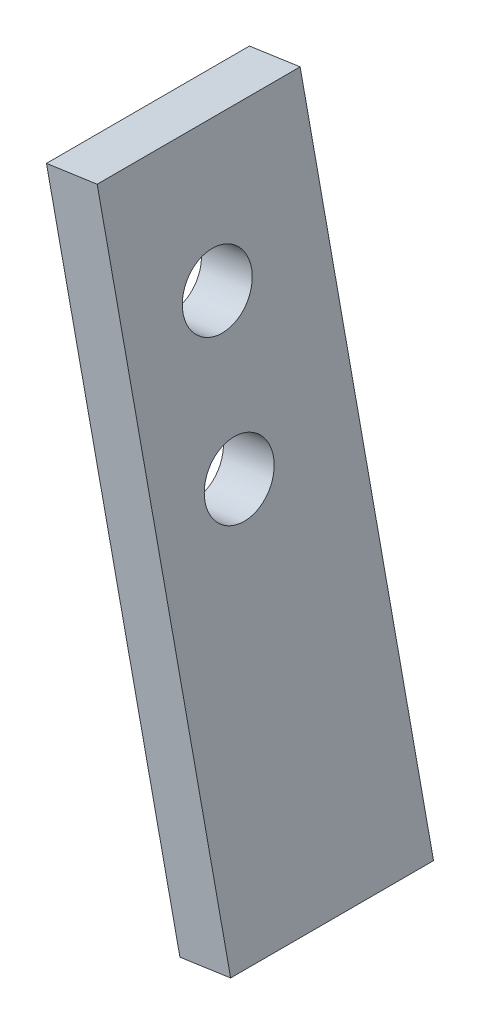
from build123d import *

# Parameters (mm, degrees)
SKETCH2_R           = 3.377890651
BOSS_EXTRUDE1_DEPTH = 5


with BuildPart() as part:
    # Sketch2 → Boss-Extrude1 (new body)
    with BuildSketch(Plane(origin=(-15.215309572, -2.572413543, 84.911881155), x_dir=(0, 0, 1), z_dir=(-0.9897749348145017, -0.1426379276803648, 0))):
        Polygon((0, 0), (-19.810711601, 0.012695688), (-23.557031025, -64.984916832), (-3.752176578, -64.997608766), align=None)
        with Locations((-9.849967398, -13.121901357)):
            Circle(SKETCH2_R, mode=Mode.SUBTRACT)
        with Locations((-9.849967398, -28.121901357)):
            Circle(SKETCH2_R, mode=Mode.SUBTRACT)
    extrude(amount=-BOSS_EXTRUDE1_DEPTH)


solid = part.part
